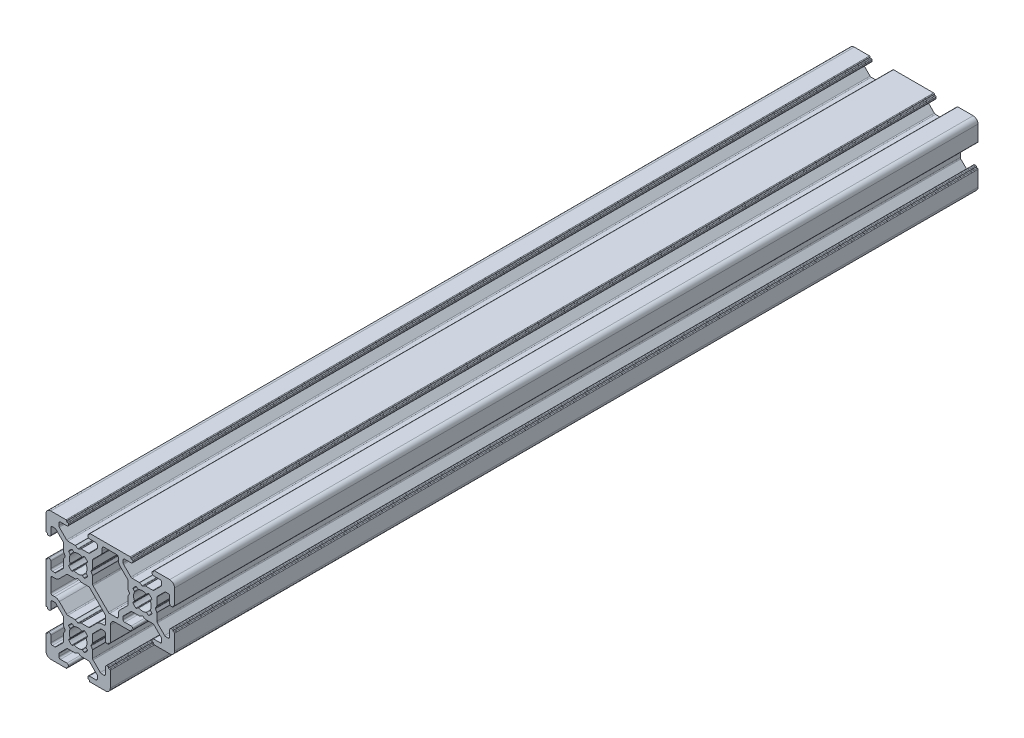
from build123d import *

# Parameters (mm, degrees)
EXTRUDE1_DEPTH = 250


with BuildPart() as part:
    # Sketch1 → Extrude1 (new body)
    with BuildSketch(Plane.XY):
        with BuildLine():
            ThreePointArc((-3.349999093, 9.500000035), (-3.491420449, 9.558578679), (-3.549999093, 9.700000035))
            Line((-3.549999093, 9.700000035), (-3.549999093, 9.8))
            ThreePointArc((-3.549999093, 9.8), (-3.608577737, 9.941421356), (-3.749999093, 10))
            Line((-3.749999093, 10), (-8.5, 10))
            ThreePointArc((-8.5, 10), (-9.560660172, 9.560660172), (-10, 8.5))
            Line((-10, 8.5), (-10, 3.74999686))
            ThreePointArc((-10, 3.74999686), (-9.941421356, 3.608575504), (-9.8, 3.54999686))
            Line((-9.8, 3.54999686), (-9.699999974, 3.54999686))
            ThreePointArc((-9.699999974, 3.54999686), (-9.558578617, 3.491418217), (-9.499999974, 3.34999686))
            Line((-9.499999974, 3.34999686), (-9.499999974, 3.2))
            ThreePointArc((-9.499999974, 3.2), (-9.44142133, 3.058578644), (-9.299999974, 3))
            Line((-9.299999974, 3), (-9.000000004, 3))
            ThreePointArc((-9.000000004, 3), (-8.646446614, 3.146446609), (-8.500000004, 3.5))
            Line((-8.500000004, 3.5), (-8.500000004, 5.499996953))
            ThreePointArc((-8.500000004, 5.499996953), (-8.353553395, 5.853550343), (-8.000000004, 5.999996953))
            Line((-8.000000004, 5.999996953), (-7.267766701, 5.999996953))
            ThreePointArc((-7.267766701, 5.999996953), (-7.076425, 5.961936725), (-6.914213334, 5.853550367))
            Line((-6.914213334, 5.853550367), (-4.646446288, 3.58578362))
            ThreePointArc((-4.646446288, 3.58578362), (-4.538059895, 3.423571938), (-4.499999655, 3.232230206))
            Line((-4.499999655, 3.232230206), (-4.499999655, 0.953586855))
            ThreePointArc((-4.499999655, 0.953586855), (-4.493184823, 0.901823054), (-4.473204745, 0.85358687))
            Line((-4.473204745, 0.85358687), (-4.038120056, 0.099997927))
            ThreePointArc((-4.038120056, 0.099997927), (-4.011325146, -2.058e-06), (-4.038120056, -0.100002042))
            Line((-4.038120056, -0.100002042), (-4.473204745, -0.853590986))
            ThreePointArc((-4.473204745, -0.853590986), (-4.493184823, -0.90182717), (-4.499999655, -0.95359097))
            Line((-4.499999655, -0.95359097), (-4.499999655, -3.232234321))
            ThreePointArc((-4.499999655, -3.232234321), (-4.538059901, -3.423576066), (-4.646446308, -3.585787755))
            Line((-4.646446308, -3.585787755), (-6.91421348, -5.853554375))
            ThreePointArc((-6.91421348, -5.853554375), (-7.076425139, -5.961940719), (-7.267766827, -6.000000942))
            Line((-7.267766827, -6.000000942), (-8.000000004, -6.000000942))
            ThreePointArc((-8.000000004, -6.000000942), (-8.353553395, -5.853554332), (-8.500000004, -5.500000942))
            Line((-8.500000004, -5.500000942), (-8.500000004, -3.5))
            ThreePointArc((-8.500000004, -3.5), (-8.646446614, -3.146446609), (-9.000000004, -3))
            Line((-9.000000004, -3), (-9.299999932, -3))
            ThreePointArc((-9.299999932, -3), (-9.441421288, -3.058578644), (-9.499999932, -3.2))
            Line((-9.499999932, -3.2), (-9.499999932, -3.350000313))
            ThreePointArc((-9.499999932, -3.350000313), (-9.558578576, -3.491421669), (-9.699999932, -3.550000313))
            Line((-9.699999932, -3.550000313), (-9.8, -3.550000313))
            ThreePointArc((-9.8, -3.550000313), (-9.941421356, -3.608578957), (-10, -3.750000313))
            Line((-10, -3.750000313), (-10, -16.250001185))
            ThreePointArc((-10, -16.250001185), (-9.941421356, -16.391422541), (-9.8, -16.450001185))
            Line((-9.8, -16.450001185), (-9.699999983, -16.450001185))
            ThreePointArc((-9.699999983, -16.450001185), (-9.558578627, -16.508579828), (-9.499999983, -16.650001185))
            Line((-9.499999983, -16.650001185), (-9.499999983, -16.8))
            ThreePointArc((-9.499999983, -16.8), (-9.44142134, -16.941421356), (-9.299999983, -17))
            Line((-9.299999983, -17), (-9.000000004, -17))
            ThreePointArc((-9.000000004, -17), (-8.646446614, -16.853553391), (-8.500000004, -16.5))
            Line((-8.500000004, -16.5), (-8.500000004, -14.500001126))
            ThreePointArc((-8.500000004, -14.500001126), (-8.353553395, -14.146447735), (-8.000000004, -14.000001126))
            Line((-8.000000004, -14.000001126), (-7.267766646, -14.000001126))
            ThreePointArc((-7.267766646, -14.000001126), (-7.07642494, -14.038061356), (-6.91421327, -14.146447721))
            Line((-6.91421327, -14.146447721), (-4.646446279, -16.414214522))
            ThreePointArc((-4.646446279, -16.414214522), (-4.538059893, -16.576426202), (-4.499999655, -16.767767927))
            Line((-4.499999655, -16.767767927), (-4.499999655, -19.046411279))
            ThreePointArc((-4.499999655, -19.046411279), (-4.493184822, -19.098175082), (-4.473204743, -19.146411267))
            Line((-4.473204743, -19.146411267), (-4.038120036, -19.9000002))
            ThreePointArc((-4.038120036, -19.9000002), (-4.011325123, -20.000000189), (-4.038120036, -20.100000178))
            Line((-4.038120036, -20.100000178), (-4.473204743, -20.853589111))
            ThreePointArc((-4.473204743, -20.853589111), (-4.493184822, -20.901825297), (-4.499999655, -20.953589099))
            Line((-4.499999655, -20.953589099), (-4.499999655, -23.232232451))
            ThreePointArc((-4.499999655, -23.232232451), (-4.53805988, -23.423574146), (-4.646446233, -23.585785809))
            Line((-4.646446233, -23.585785809), (-6.914212923, -25.853552911))
            ThreePointArc((-6.914212923, -25.853552911), (-7.076424609, -25.96193931), (-7.267766346, -25.999999552))
            Line((-7.267766346, -25.999999552), (-8.000000004, -25.999999552))
            ThreePointArc((-8.000000004, -25.999999552), (-8.353553395, -25.853552943), (-8.500000004, -25.499999552))
            Line((-8.500000004, -25.499999552), (-8.500000004, -23.5))
            ThreePointArc((-8.500000004, -23.5), (-8.646446614, -23.146446609), (-9.000000004, -23))
            Line((-9.000000004, -23), (-9.300000017, -23))
            ThreePointArc((-9.300000017, -23), (-9.441421373, -23.058578644), (-9.500000017, -23.2))
            Line((-9.500000017, -23.2), (-9.500000017, -23.349999221))
            ThreePointArc((-9.500000017, -23.349999221), (-9.55857866, -23.491420577), (-9.700000017, -23.549999221))
            Line((-9.700000017, -23.549999221), (-9.8, -23.549999221))
            ThreePointArc((-9.8, -23.549999221), (-9.941421356, -23.608577865), (-10, -23.749999221))
            Line((-10, -23.749999221), (-10, -28.5))
            ThreePointArc((-10, -28.5), (-9.560660172, -29.560660172), (-8.5, -30))
            Line((-8.5, -30), (-3.7, -30))
            ThreePointArc((-3.7, -30), (-3.558578644, -29.941421356), (-3.5, -29.8))
            Line((-3.5, -29.8), (-3.5, -29.700000035))
            ThreePointArc((-3.5, -29.700000035), (-3.441421356, -29.558578679), (-3.3, -29.500000035))
            Line((-3.3, -29.500000035), (-3.2, -29.500000035))
            ThreePointArc((-3.2, -29.500000035), (-3.058578644, -29.441421391), (-3, -29.300000035))
            Line((-3, -29.300000035), (-3, -28.999999024))
            ThreePointArc((-3, -28.999999024), (-3.146446609, -28.646445633), (-3.5, -28.499999024))
            Line((-3.5, -28.499999024), (-5.499999354, -28.499999024))
            ThreePointArc((-5.499999354, -28.499999024), (-5.853552745, -28.353552415), (-5.999999354, -27.999999024))
            Line((-5.999999354, -27.999999024), (-5.999999354, -27.267766099))
            ThreePointArc((-5.999999354, -27.267766099), (-5.961939116, -27.076424371), (-5.853552727, -26.914212691))
            Line((-5.853552727, -26.914212691), (-3.585785721, -24.646445905))
            ThreePointArc((-3.585785721, -24.646445905), (-3.423574052, -24.538059542), (-3.232232347, -24.499999313))
            Line((-3.232232347, -24.499999313), (-0.953588906, -24.499999313))
            ThreePointArc((-0.953588906, -24.499999313), (-0.9018251, -24.493184479), (-0.853588911, -24.473204396))
            Line((-0.853588911, -24.473204396), (-0.099999996, -24.038119658))
            ThreePointArc((-0.099999996, -24.038119658), (5e-09, -24.011324741), (0.100000004, -24.038119663))
            Line((0.100000004, -24.038119663), (0.853588898, -24.473204438))
            ThreePointArc((0.853588898, -24.473204438), (0.901825091, -24.493184524), (0.953588902, -24.49999936))
            Line((0.953588902, -24.49999936), (3.232232236, -24.49999936))
            ThreePointArc((3.232232236, -24.49999936), (3.423573952, -24.538059593), (3.585785626, -24.646445969))
            Line((3.585785626, -24.646445969), (5.853552522, -26.914212865))
            ThreePointArc((5.853552522, -26.914212865), (5.961938898, -27.07642454), (5.999999132, -27.267766256))
            Line((5.999999132, -27.267766256), (5.999999132, -27.999999024))
            ThreePointArc((5.999999132, -27.999999024), (5.853552522, -28.353552415), (5.499999132, -28.499999024))
            Line((5.499999132, -28.499999024), (3.5, -28.499999024))
            ThreePointArc((3.5, -28.499999024), (3.146446609, -28.646445633), (3, -28.999999024))
            Line((3, -28.999999024), (3, -29.299999459))
            ThreePointArc((3, -29.299999459), (3.058578644, -29.441420815), (3.2, -29.499999459))
            Line((3.2, -29.499999459), (3.299999981, -29.499999459))
            ThreePointArc((3.299999981, -29.499999459), (3.441421337, -29.558578103), (3.499999981, -29.699999459))
            Line((3.499999981, -29.699999459), (3.499999981, -29.8))
            ThreePointArc((3.499999981, -29.8), (3.558578624, -29.941421356), (3.699999981, -30))
            Line((3.699999981, -30), (8.5, -30))
            ThreePointArc((8.5, -30), (9.560660172, -29.560660172), (10, -28.5))
            Line((10, -28.5), (10, -23.700000019))
            ThreePointArc((10, -23.700000019), (9.941421356, -23.558578663), (9.8, -23.500000019))
            Line((9.8, -23.500000019), (9.700000017, -23.500000019))
            ThreePointArc((9.700000017, -23.500000019), (9.55857866, -23.441421376), (9.500000017, -23.300000019))
            Line((9.500000017, -23.300000019), (9.500000017, -23.2))
            ThreePointArc((9.500000017, -23.2), (9.441421373, -23.058578644), (9.300000017, -23))
            Line((9.300000017, -23), (9.000000004, -23))
            ThreePointArc((9.000000004, -23), (8.646446614, -23.146446609), (8.500000004, -23.5))
            Line((8.500000004, -23.5), (8.500000004, -25.499999272))
            ThreePointArc((8.500000004, -25.499999272), (8.353553395, -25.853552663), (8.000000004, -25.999999272))
            Line((8.000000004, -25.999999272), (7.267766483, -25.999999272))
            ThreePointArc((7.267766483, -25.999999272), (7.076424756, -25.961939034), (6.914213075, -25.853552645))
            Line((6.914213075, -25.853552645), (4.64644629, -23.585785639))
            ThreePointArc((4.64644629, -23.585785639), (4.538059927, -23.42357397), (4.499999697, -23.232232265))
            Line((4.499999697, -23.232232265), (4.499999697, -20.953588914))
            ThreePointArc((4.499999697, -20.953588914), (4.493184866, -20.901825115), (4.473204789, -20.853588932))
            Line((4.473204789, -20.853588932), (4.038120113, -20.099999981))
            ThreePointArc((4.038120113, -20.099999981), (4.011325205, -20), (4.038120113, -19.900000019))
            Line((4.038120113, -19.900000019), (4.473204789, -19.146411068))
            ThreePointArc((4.473204789, -19.146411068), (4.493184866, -19.098174885), (4.499999697, -19.046411086))
            Line((4.499999697, -19.046411086), (4.499999697, -16.767767735))
            ThreePointArc((4.499999697, -16.767767735), (4.538059931, -16.576426018), (4.646446307, -16.414214344))
            Line((4.646446307, -16.414214344), (6.914213203, -14.146447448))
            ThreePointArc((6.914213203, -14.146447448), (7.076424877, -14.038061072), (7.267766594, -14.000000839))
            Line((7.267766594, -14.000000839), (8.000000004, -14.000000839))
            ThreePointArc((8.000000004, -14.000000839), (8.353553395, -14.146447448), (8.500000004, -14.500000839))
            Line((8.500000004, -14.500000839), (8.500000004, -16.5))
            ThreePointArc((8.500000004, -16.5), (8.646446614, -16.853553391), (9.000000004, -17))
            Line((9.000000004, -17), (9.299999983, -17))
            ThreePointArc((9.299999983, -17), (9.44142134, -16.941421356), (9.499999983, -16.8))
            Line((9.499999983, -16.8), (9.499999983, -16.700000055))
            ThreePointArc((9.499999983, -16.700000055), (9.558578627, -16.558578699), (9.699999983, -16.500000055))
            Line((9.699999983, -16.500000055), (9.8, -16.500000055))
            ThreePointArc((9.8, -16.500000055), (9.941421356, -16.441421411), (10, -16.300000055))
            Line((10, -16.300000055), (10, -11.5))
            ThreePointArc((10, -11.5), (10.439339828, -10.439339828), (11.5, -10))
            Line((11.5, -10), (16.250000159, -10))
            ThreePointArc((16.250000159, -10), (16.391421515, -9.941421356), (16.450000159, -9.8))
            Line((16.450000159, -9.8), (16.450000159, -9.699999841))
            ThreePointArc((16.450000159, -9.699999841), (16.508578802, -9.558578485), (16.650000159, -9.499999841))
            Line((16.650000159, -9.499999841), (16.8, -9.499999841))
            ThreePointArc((16.8, -9.499999841), (16.941421356, -9.441421197), (17, -9.299999841))
            Line((17, -9.299999841), (17, -8.999999024))
            ThreePointArc((17, -8.999999024), (16.853553391, -8.646445633), (16.5, -8.499999024))
            Line((16.5, -8.499999024), (14.500002214, -8.499999024))
            ThreePointArc((14.500002214, -8.499999024), (14.146448895, -8.353552487), (14.000002214, -7.999999227))
            Line((14.000002214, -7.999999227), (14.000001917, -7.267767338))
            ThreePointArc((14.000001917, -7.267767338), (14.038062066, -7.076425653), (14.146448356, -6.914213977))
            Line((14.146448356, -6.914213977), (16.414214441, -4.646446269))
            ThreePointArc((16.414214441, -4.646446269), (16.576426159, -4.538059801), (16.767767958, -4.499999533))
            Line((16.767767958, -4.499999533), (19.046411123, -4.499999533))
            ThreePointArc((19.046411123, -4.499999533), (19.098174961, -4.493184691), (19.146411175, -4.473204584))
            Line((19.146411175, -4.473204584), (19.899999947, -4.038119598))
            ThreePointArc((19.899999947, -4.038119598), (20, -4.011324649), (20.100000053, -4.038119598))
            Line((20.100000053, -4.038119598), (20.853588825, -4.473204584))
            ThreePointArc((20.853588825, -4.473204584), (20.901825039, -4.493184691), (20.953588877, -4.499999533))
            Line((20.953588877, -4.499999533), (23.232232042, -4.499999533))
            ThreePointArc((23.232232042, -4.499999533), (23.423573758, -4.538059767), (23.585785433, -4.646446143))
            Line((23.585785433, -4.646446143), (25.853552329, -6.914213039))
            ThreePointArc((25.853552329, -6.914213039), (25.961938704, -7.076424713), (25.999998938, -7.26776643))
            Line((25.999998938, -7.26776643), (25.999998938, -7.999999024))
            ThreePointArc((25.999998938, -7.999999024), (25.853552329, -8.353552415), (25.499998938, -8.499999024))
            Line((25.499998938, -8.499999024), (23.5, -8.499999024))
            ThreePointArc((23.5, -8.499999024), (23.146446609, -8.646445633), (23, -8.999999024))
            Line((23, -8.999999024), (23, -9.3))
            ThreePointArc((23, -9.3), (23.058578644, -9.441421356), (23.2, -9.5))
            Line((23.2, -9.5), (23.3, -9.5))
            ThreePointArc((23.3, -9.5), (23.441421356, -9.558578644), (23.5, -9.7))
            Line((23.5, -9.7), (23.5, -9.8))
            ThreePointArc((23.5, -9.8), (23.558578644, -9.941421356), (23.7, -10))
            Line((23.7, -10), (28.5, -10))
            ThreePointArc((28.5, -10), (29.560660172, -9.560660172), (30, -8.5))
            Line((30, -8.5), (30, -3.699999946))
            ThreePointArc((30, -3.699999946), (29.941421356, -3.55857859), (29.8, -3.499999946))
            Line((29.8, -3.499999946), (29.699999932, -3.499999946))
            ThreePointArc((29.699999932, -3.499999946), (29.558578576, -3.441421303), (29.499999932, -3.299999946))
            Line((29.499999932, -3.299999946), (29.499999932, -3.2))
            ThreePointArc((29.499999932, -3.2), (29.441421288, -3.058578644), (29.299999932, -3))
            Line((29.299999932, -3), (29.000000004, -3))
            ThreePointArc((29.000000004, -3), (28.646446614, -3.146446609), (28.500000004, -3.5))
            Line((28.500000004, -3.5), (28.500000004, -5.499999276))
            ThreePointArc((28.500000004, -5.499999276), (28.353553395, -5.853552666), (28.000000004, -5.999999276))
            Line((28.000000004, -5.999999276), (27.26776694, -5.999999276))
            ThreePointArc((27.26776694, -5.999999276), (27.076425213, -5.961939037), (26.914213532, -5.853552649))
            Line((26.914213532, -5.853552649), (24.646446747, -3.585785642))
            ThreePointArc((24.646446747, -3.585785642), (24.538060384, -3.423573974), (24.500000155, -3.232232269))
            Line((24.500000155, -3.232232269), (24.500000155, -0.953588917))
            ThreePointArc((24.500000155, -0.953588917), (24.493185324, -0.901825123), (24.47320525, -0.853588943))
            Line((24.47320525, -0.853588943), (24.038120606, -0.099999974))
            ThreePointArc((24.038120606, -0.099999974), (24.011325701, 0), (24.038120606, 0.099999974))
            Line((24.038120606, 0.099999974), (24.47320525, 0.853588943))
            ThreePointArc((24.47320525, 0.853588943), (24.493185324, 0.901825123), (24.500000155, 0.953588917))
            Line((24.500000155, 0.953588917), (24.500000155, 3.232232269))
            ThreePointArc((24.500000155, 3.232232269), (24.538060388, 3.423573985), (24.646446764, 3.58578566))
            Line((24.646446764, 3.58578566), (26.91421366, 5.853552556))
            ThreePointArc((26.91421366, 5.853552556), (27.076425335, 5.961938931), (27.267767051, 5.999999165))
            Line((27.267767051, 5.999999165), (28.000000004, 5.999999165))
            ThreePointArc((28.000000004, 5.999999165), (28.353553395, 5.853552556), (28.500000004, 5.499999165))
            Line((28.500000004, 5.499999165), (28.500000004, 3.5))
            ThreePointArc((28.500000004, 3.5), (28.646446614, 3.146446609), (29.000000004, 3))
            Line((29.000000004, 3), (29.299999974, 3))
            ThreePointArc((29.299999974, 3), (29.44142133, 3.058578644), (29.499999974, 3.2))
            Line((29.499999974, 3.2), (29.499999974, 3.3))
            ThreePointArc((29.499999974, 3.3), (29.558578617, 3.441421356), (29.699999974, 3.5))
            Line((29.699999974, 3.5), (29.8, 3.5))
            ThreePointArc((29.8, 3.5), (29.941421356, 3.558578644), (30, 3.7))
            Line((30, 3.7), (30, 8.5))
            ThreePointArc((30, 8.5), (29.560660172, 9.560660172), (28.5, 10))
            Line((28.5, 10), (23.700000038, 10))
            ThreePointArc((23.700000038, 10), (23.558578681, 9.941421356), (23.500000038, 9.8))
            Line((23.500000038, 9.8), (23.500000038, 9.7))
            ThreePointArc((23.500000038, 9.7), (23.441421394, 9.558578644), (23.300000038, 9.5))
            Line((23.300000038, 9.5), (23.2, 9.5))
            ThreePointArc((23.2, 9.5), (23.058578644, 9.441421356), (23, 9.3))
            Line((23, 9.3), (23, 8.999999024))
            ThreePointArc((23, 8.999999024), (23.146446609, 8.646445633), (23.5, 8.499999024))
            Line((23.5, 8.499999024), (25.499997513, 8.499999024))
            ThreePointArc((25.499997513, 8.499999024), (25.853550903, 8.353552415), (25.999997513, 7.999999024))
            Line((25.999997513, 7.999999024), (25.999997513, 7.267767494))
            ThreePointArc((25.999997513, 7.267767494), (25.961937265, 7.076425745), (25.853550853, 6.914214053))
            Line((25.853550853, 6.914214053), (23.585783633, 4.64644748))
            ThreePointArc((23.585783633, 4.64644748), (23.423571976, 4.538061141), (23.232230293, 4.500000921))
            Line((23.232230293, 4.500000921), (20.953586941, 4.500000921))
            ThreePointArc((20.953586941, 4.500000921), (20.901823144, 4.49318609), (20.853586962, 4.473206014))
            Line((20.853586962, 4.473206014), (20.099998006, 4.038121346))
            ThreePointArc((20.099998006, 4.038121346), (19.999998026, 4.011326439), (19.899998047, 4.038121346))
            Line((19.899998047, 4.038121346), (19.146409091, 4.473206014))
            ThreePointArc((19.146409091, 4.473206014), (19.098172909, 4.49318609), (19.046409112, 4.500000921))
            Line((19.046409112, 4.500000921), (16.76776576, 4.500000921))
            ThreePointArc((16.76776576, 4.500000921), (16.576424022, 4.538061164), (16.414212336, 4.646447564))
            Line((16.414212336, 4.646447564), (14.146445653, 6.914214673))
            ThreePointArc((14.146445653, 6.914214673), (14.038059137, 7.076426583), (13.999998854, 7.267768569))
            Line((13.999998854, 7.267768569), (13.999998854, 7.999999024))
            ThreePointArc((13.999998854, 7.999999024), (14.146445464, 8.353552415), (14.499998854, 8.499999024))
            Line((14.499998854, 8.499999024), (16.5, 8.499999024))
            ThreePointArc((16.5, 8.499999024), (16.853553391, 8.646445633), (17, 8.999999024))
            Line((17, 8.999999024), (17, 9.299999841))
            ThreePointArc((17, 9.299999841), (16.941421356, 9.441421197), (16.8, 9.499999841))
            Line((16.8, 9.499999841), (16.599999385, 9.499999841))
            ThreePointArc((16.599999385, 9.499999841), (16.458578029, 9.558578485), (16.399999385, 9.699999841))
            Line((16.399999385, 9.699999841), (16.399999385, 9.799999995))
            ThreePointArc((16.399999385, 9.799999995), (16.341420743, 9.941421355), (16.199999385, 10))
            Line((16.199999385, 10), (3.700000038, 10))
            ThreePointArc((3.700000038, 10), (3.558578681, 9.941421356), (3.500000038, 9.8))
            Line((3.500000038, 9.8), (3.500000038, 9.699999459))
            ThreePointArc((3.500000038, 9.699999459), (3.441421394, 9.558578103), (3.300000038, 9.499999459))
            Line((3.300000038, 9.499999459), (3.2, 9.499999459))
            ThreePointArc((3.2, 9.499999459), (3.058578644, 9.441420815), (3, 9.299999459))
            Line((3, 9.299999459), (3, 8.999999024))
            ThreePointArc((3, 8.999999024), (3.146446609, 8.646445633), (3.5, 8.499999024))
            Line((3.5, 8.499999024), (5.499999619, 8.499999024))
            ThreePointArc((5.499999619, 8.499999024), (5.85355301, 8.353552415), (5.999999619, 7.999999024))
            Line((5.999999619, 7.999999024), (5.999999619, 7.267767494))
            ThreePointArc((5.999999619, 7.267767494), (5.961939372, 7.076425745), (5.853552959, 6.914214053))
            Line((5.853552959, 6.914214053), (3.585785739, 4.64644748))
            ThreePointArc((3.585785739, 4.64644748), (3.423574083, 4.538061141), (3.232232399, 4.500000921))
            Line((3.232232399, 4.500000921), (0.953589048, 4.500000921))
            ThreePointArc((0.953589048, 4.500000921), (0.90182525, 4.49318609), (0.853589068, 4.473206014))
            Line((0.853589068, 4.473206014), (0.100000113, 4.038121346))
            ThreePointArc((0.100000113, 4.038121346), (1.33e-07, 4.011326439), (-0.099999846, 4.038121346))
            Line((-0.099999846, 4.038121346), (-0.853588802, 4.473206014))
            ThreePointArc((-0.853588802, 4.473206014), (-0.901824984, 4.49318609), (-0.953588782, 4.500000921))
            Line((-0.953588782, 4.500000921), (-3.232232133, 4.500000921))
            ThreePointArc((-3.232232133, 4.500000921), (-3.423573871, 4.538061164), (-3.585785557, 4.646447564))
            Line((-3.585785557, 4.646447564), (-5.85355224, 6.914214673))
            ThreePointArc((-5.85355224, 6.914214673), (-5.961938591, 7.076426336), (-5.999998816, 7.267768031))
            Line((-5.999998816, 7.267768031), (-5.999998816, 7.999999024))
            ThreePointArc((-5.999998816, 7.999999024), (-5.853552207, 8.353552415), (-5.499998816, 8.499999024))
            Line((-5.499998816, 8.499999024), (-3.5, 8.499999024))
            ThreePointArc((-3.5, 8.499999024), (-3.146446609, 8.646445633), (-3, 8.999999024))
            Line((-3, 8.999999024), (-3, 9.300000035))
            ThreePointArc((-3, 9.300000035), (-3.058578644, 9.441421391), (-3.2, 9.500000035))
            Line((-3.2, 9.500000035), (-3.349999093, 9.500000035))
        make_face()
        with BuildLine():
            Line((2.891601882, 1.800596901), (2.525869345, 1.362297701))
            ThreePointArc((2.525869345, 1.362297701), (2.481166892, 1.260459554), (2.497774017, 1.150489009))
            ThreePointArc((2.497774017, 1.150489009), (2.75, 0), (2.497774017, -1.150489009))
            ThreePointArc((2.497774017, -1.150489009), (2.481166892, -1.260459554), (2.525869345, -1.362297701))
            Line((2.525869345, -1.362297701), (2.891601882, -1.800596901))
            ThreePointArc((2.891601882, -1.800596901), (2.937874062, -1.920565777), (2.90154698, -2.043910777))
            ThreePointArc((2.90154698, -2.043910777), (2.509635983, -2.509636105), (2.043910636, -2.90154708))
            ThreePointArc((2.043910636, -2.90154708), (1.920565634, -2.937874155), (1.80059676, -2.891601969))
            Line((1.80059676, -2.891601969), (1.362297578, -2.525869411))
            ThreePointArc((1.362297578, -2.525869411), (1.260459433, -2.481166953), (1.150488887, -2.497774073))
            ThreePointArc((1.150488887, -2.497774073), (0.003771764, -2.749997413), (-1.143632919, -2.50092058))
            ThreePointArc((-1.143632919, -2.50092058), (-1.253648606, -2.484615182), (-1.355363744, -2.529596824))
            Line((-1.355363744, -2.529596824), (-1.792658037, -2.896530304))
            ThreePointArc((-1.792658037, -2.896530304), (-1.91249953, -2.943131403), (-2.035943717, -2.907142811))
            ThreePointArc((-2.035943717, -2.907142811), (-2.506191529, -2.513075837), (-2.90154698, -2.043910777))
            ThreePointArc((-2.90154698, -2.043910777), (-2.937862671, -1.920291704), (-2.891249812, -1.80017615))
            Line((-2.891249812, -1.80017615), (-2.524316353, -1.362881839))
            ThreePointArc((-2.524316353, -1.362881839), (-2.480347373, -1.261339557), (-2.497095362, -1.151961263))
            ThreePointArc((-2.497095362, -1.151961263), (-2.74997358, 0.012054474), (-2.48690038, 1.173808544))
            ThreePointArc((-2.48690038, 1.173808544), (-2.481329958, 1.273149679), (-2.524316353, 1.362881839))
            Line((-2.524316353, 1.362881839), (-2.891249812, 1.80017615))
            ThreePointArc((-2.891249812, 1.80017615), (-2.937862671, 1.920291704), (-2.90154698, 2.043910777))
            ThreePointArc((-2.90154698, 2.043910777), (-2.509635983, 2.509636105), (-2.043910636, 2.90154708))
            ThreePointArc((-2.043910636, 2.90154708), (-1.920565634, 2.937874155), (-1.80059676, 2.891601969))
            Line((-1.80059676, 2.891601969), (-1.362297578, 2.525869411))
            ThreePointArc((-1.362297578, 2.525869411), (-1.260459433, 2.481166953), (-1.150488887, 2.497774073))
            ThreePointArc((-1.150488887, 2.497774073), (0, 2.75), (1.150488887, 2.497774073))
            ThreePointArc((1.150488887, 2.497774073), (1.260459433, 2.481166953), (1.362297578, 2.525869411))
            Line((1.362297578, 2.525869411), (1.80059676, 2.891601969))
            ThreePointArc((1.80059676, 2.891601969), (1.920565634, 2.937874155), (2.043910636, 2.90154708))
            ThreePointArc((2.043910636, 2.90154708), (2.509635983, 2.509636105), (2.90154698, 2.043910777))
            ThreePointArc((2.90154698, 2.043910777), (2.937874062, 1.920565777), (2.891601882, 1.800596901))
        make_face(mode=Mode.SUBTRACT)
        with BuildLine():
            Line((-1.80059676, -17.108398031), (-1.362297578, -17.474130589))
            ThreePointArc((-1.362297578, -17.474130589), (-1.260459433, -17.518833047), (-1.150488887, -17.502225927))
            ThreePointArc((-1.150488887, -17.502225927), (1.34e-07, -17.25), (1.150489131, -17.502226039))
            ThreePointArc((1.150489131, -17.502226039), (1.260459675, -17.51883317), (1.362297824, -17.474130722))
            Line((1.362297824, -17.474130722), (1.800597042, -17.108398206))
            ThreePointArc((1.800597042, -17.108398206), (1.92056592, -17.062126032), (2.043910919, -17.098453119))
            ThreePointArc((2.043910919, -17.098453119), (2.509636227, -17.49036414), (2.901547179, -17.956089505))
            ThreePointArc((2.901547179, -17.956089505), (2.937874249, -18.079434509), (2.891602057, -18.199403381))
            Line((2.891602057, -18.199403381), (2.525869478, -18.637702545))
            ThreePointArc((2.525869478, -18.637702545), (2.481167014, -18.739540688), (2.497774129, -18.849511234))
            ThreePointArc((2.497774129, -18.849511234), (2.75, -20.000000134), (2.497774017, -21.150489009))
            ThreePointArc((2.497774017, -21.150489009), (2.481166892, -21.260459554), (2.525869345, -21.362297701))
            Line((2.525869345, -21.362297701), (2.891601882, -21.800596901))
            ThreePointArc((2.891601882, -21.800596901), (2.937874062, -21.920565777), (2.90154698, -22.043910777))
            ThreePointArc((2.90154698, -22.043910777), (2.509635983, -22.509636105), (2.043910636, -22.90154708))
            ThreePointArc((2.043910636, -22.90154708), (1.920565634, -22.937874155), (1.80059676, -22.891601969))
            Line((1.80059676, -22.891601969), (1.362297578, -22.525869411))
            ThreePointArc((1.362297578, -22.525869411), (1.260459433, -22.481166953), (1.150488887, -22.497774073))
            ThreePointArc((1.150488887, -22.497774073), (-1.34e-07, -22.75), (-1.150489131, -22.497773961))
            ThreePointArc((-1.150489131, -22.497773961), (-1.260459675, -22.48116683), (-1.362297824, -22.525869278))
            Line((-1.362297824, -22.525869278), (-1.800597042, -22.891601794))
            ThreePointArc((-1.800597042, -22.891601794), (-1.92056592, -22.937873968), (-2.043910919, -22.901546881))
            ThreePointArc((-2.043910919, -22.901546881), (-2.509636227, -22.50963586), (-2.901547179, -22.043910495))
            ThreePointArc((-2.901547179, -22.043910495), (-2.937874249, -21.920565491), (-2.891602057, -21.800596619))
            Line((-2.891602057, -21.800596619), (-2.525869478, -21.362297455))
            ThreePointArc((-2.525869478, -21.362297455), (-2.481167014, -21.260459312), (-2.497774129, -21.150488766))
            ThreePointArc((-2.497774129, -21.150488766), (-2.75, -19.999999866), (-2.497774017, -18.849510991))
            ThreePointArc((-2.497774017, -18.849510991), (-2.481166892, -18.739540446), (-2.525869345, -18.637702299))
            Line((-2.525869345, -18.637702299), (-2.891601882, -18.199403099))
            ThreePointArc((-2.891601882, -18.199403099), (-2.937874062, -18.079434223), (-2.90154698, -17.956089223))
            ThreePointArc((-2.90154698, -17.956089223), (-2.509635983, -17.490363895), (-2.043910636, -17.09845292))
            ThreePointArc((-2.043910636, -17.09845292), (-1.920565634, -17.062125845), (-1.80059676, -17.108398031))
        make_face(mode=Mode.SUBTRACT)
        with BuildLine():
            ThreePointArc((-3.585784816, -4.646446143), (-3.423573142, -4.538059767), (-3.232231426, -4.499999533))
            Line((-3.232231426, -4.499999533), (-0.953588261, -4.499999533))
            ThreePointArc((-0.953588261, -4.499999533), (-0.901824463, -4.493184702), (-0.853588281, -4.473204626))
            Line((-0.853588281, -4.473204626), (-0.099999326, -4.038119959))
            ThreePointArc((-0.099999326, -4.038119959), (6.54e-07, -4.011325051), (0.100000633, -4.038119959))
            Line((0.100000633, -4.038119959), (0.853589589, -4.473204626))
            ThreePointArc((0.853589589, -4.473204626), (0.901825771, -4.493184702), (0.953589569, -4.499999533))
            Line((0.953589569, -4.499999533), (3.232232733, -4.499999533))
            ThreePointArc((3.232232733, -4.499999533), (3.423574417, -4.538059754), (3.585786074, -4.646446092))
            Line((3.585786074, -4.646446092), (8.353553344, -9.414212002))
            ThreePointArc((8.353553344, -9.414212002), (8.461939757, -9.576423694), (8.500000004, -9.767765443))
            Line((8.500000004, -9.767765443), (8.500000004, -12.000000777))
            ThreePointArc((8.500000004, -12.000000777), (8.353553395, -12.353554167), (8.000000004, -12.500000777))
            Line((8.000000004, -12.500000777), (7.267766594, -12.500000777))
            ThreePointArc((7.267766594, -12.500000777), (6.502399725, -12.652241708), (5.853553018, -13.085787202))
            Line((5.853553018, -13.085787202), (3.585784564, -15.353555557))
            ThreePointArc((3.585784564, -15.353555557), (3.423572875, -15.461941934), (3.232231145, -15.500002159))
            Line((3.232231145, -15.500002159), (0.953590664, -15.500001993))
            ThreePointArc((0.953590664, -15.500001993), (0.901826855, -15.506816824), (0.853590662, -15.526796904))
            Line((0.853590662, -15.526796904), (0.100001726, -15.961881606))
            ThreePointArc((0.100001726, -15.961881606), (1.724e-06, -15.988676518), (-0.099998274, -15.961881592))
            Line((-0.099998274, -15.961881592), (-0.853587146, -15.52679678))
            ThreePointArc((-0.853587146, -15.52679678), (-0.90182338, -15.50681668), (-0.953587236, -15.500001853))
            Line((-0.953587236, -15.500001853), (-3.232231076, -15.500002731))
            ThreePointArc((-3.232231076, -15.500002731), (-3.423572907, -15.461942529), (-3.585784677, -15.353556104))
            Line((-3.585784677, -15.353556104), (-5.853552971, -13.085787589))
            ThreePointArc((-5.853552971, -13.085787589), (-6.502399713, -12.652242022), (-7.267766646, -12.500001064))
            Line((-7.267766646, -12.500001064), (-8.000000004, -12.500001064))
            ThreePointArc((-8.000000004, -12.500001064), (-8.353553395, -12.353554455), (-8.500000004, -12.000001064))
            Line((-8.500000004, -12.000001064), (-8.500000004, -8.000001004))
            ThreePointArc((-8.500000004, -8.000001004), (-8.353553395, -7.646447613), (-8.000000003, -7.500001004))
            Line((-8.000000003, -7.500001004), (-7.267766827, -7.500001004))
            ThreePointArc((-7.267766827, -7.500001004), (-6.502399939, -7.347760064), (-5.853553221, -6.914214548))
            Line((-5.853553221, -6.914214548), (-3.585784816, -4.646446143))
        make_face(mode=Mode.SUBTRACT)
        with BuildLine():
            ThreePointArc((17.09845302, 2.043910777), (17.490364017, 2.509636105), (17.956089364, 2.90154708))
            ThreePointArc((17.956089364, 2.90154708), (18.07970844, 2.937862765), (18.199823991, 2.8912499))
            Line((18.199823991, 2.8912499), (18.642781084, 2.531172837))
            ThreePointArc((18.642781084, 2.531172837), (18.745145787, 2.484782204), (18.856367081, 2.50092058))
            ThreePointArc((18.856367081, 2.50092058), (20, 2.75), (21.143632919, 2.50092058))
            ThreePointArc((21.143632919, 2.50092058), (21.253648606, 2.484615182), (21.355363744, 2.529596824))
            Line((21.355363744, 2.529596824), (21.798320837, 2.889673887))
            ThreePointArc((21.798320837, 2.889673887), (21.919075686, 2.93780769), (22.043910636, 2.90154708))
            ThreePointArc((22.043910636, 2.90154708), (22.509635983, 2.509636105), (22.90154698, 2.043910777))
            ThreePointArc((22.90154698, 2.043910777), (22.937807597, 1.919075829), (22.8896738, 1.798320977))
            Line((22.8896738, 1.798320977), (22.529596758, 1.355363867))
            ThreePointArc((22.529596758, 1.355363867), (22.484615121, 1.253648727), (22.500920524, 1.143633041))
            ThreePointArc((22.500920524, 1.143633041), (22.75, 0), (22.500920524, -1.143633041))
            ThreePointArc((22.500920524, -1.143633041), (22.484615121, -1.253648727), (22.529596758, -1.355363867))
            Line((22.529596758, -1.355363867), (22.8896738, -1.798320977))
            ThreePointArc((22.8896738, -1.798320977), (22.937807597, -1.919075829), (22.90154698, -2.043910777))
            ThreePointArc((22.90154698, -2.043910777), (22.509635983, -2.509636105), (22.043910636, -2.90154708))
            ThreePointArc((22.043910636, -2.90154708), (21.919075686, -2.93780769), (21.798320837, -2.889673887))
            Line((21.798320837, -2.889673887), (21.355363744, -2.529596824))
            ThreePointArc((21.355363744, -2.529596824), (21.253648606, -2.484615182), (21.143632919, -2.50092058))
            ThreePointArc((21.143632919, -2.50092058), (20, -2.75), (18.856367081, -2.50092058))
            ThreePointArc((18.856367081, -2.50092058), (18.745145787, -2.484782204), (18.642781084, -2.531172837))
            Line((18.642781084, -2.531172837), (18.199823991, -2.8912499))
            ThreePointArc((18.199823991, -2.8912499), (18.07970844, -2.937862765), (17.956089364, -2.90154708))
            ThreePointArc((17.956089364, -2.90154708), (17.490364017, -2.509636105), (17.09845302, -2.043910777))
            ThreePointArc((17.09845302, -2.043910777), (17.062137329, -1.920291704), (17.108750188, -1.80017615))
            Line((17.108750188, -1.80017615), (17.468827229, -1.35721904))
            ThreePointArc((17.468827229, -1.35721904), (17.515217857, -1.254854334), (17.499079476, -1.143633041))
            ThreePointArc((17.499079476, -1.143633041), (17.25, 0), (17.499079476, 1.143633041))
            ThreePointArc((17.499079476, 1.143633041), (17.515217857, 1.254854334), (17.468827229, 1.35721904))
            Line((17.468827229, 1.35721904), (17.108750188, 1.80017615))
            ThreePointArc((17.108750188, 1.80017615), (17.062137329, 1.920291704), (17.09845302, 2.043910777))
        make_face(mode=Mode.SUBTRACT)
        with BuildLine():
            Line((4.499999697, 0.953588556), (4.499999697, 3.232231908))
            ThreePointArc((4.499999697, 3.232231908), (4.538059896, 3.423573539), (4.646446177, 3.585785168))
            Line((4.646446177, 3.585785168), (6.914213746, 5.853554409))
            ThreePointArc((6.914213746, 5.853554409), (7.347758882, 6.502400946), (7.499999681, 7.267767494))
            Line((7.499999681, 7.267767494), (7.499999681, 7.999999024))
            ThreePointArc((7.499999681, 7.999999024), (7.646446291, 8.353552415), (7.999999681, 8.499999024))
            Line((7.999999681, 8.499999024), (11.999999553, 8.499999024))
            ThreePointArc((11.999999553, 8.499999024), (12.353552944, 8.353552415), (12.499999553, 7.999999024))
            Line((12.499999553, 7.999999024), (12.499999553, 7.267768569))
            ThreePointArc((12.499999553, 7.267768569), (12.652240448, 6.502401788), (13.085785843, 5.853555128))
            Line((13.085785843, 5.853555128), (15.353553983, 3.585786458))
            ThreePointArc((15.353553983, 3.585786458), (15.461940328, 3.423574797), (15.500000551, 3.232233108))
            Line((15.500000551, 3.232233108), (15.500000551, 0.953589757))
            ThreePointArc((15.500000551, 0.953589757), (15.506815385, 0.901825951), (15.526795467, 0.853589762))
            Line((15.526795467, 0.853589762), (15.961880202, 0.100000845))
            ThreePointArc((15.961880202, 0.100000845), (15.988675118, 8.5e-07), (15.961880202, -0.099999145))
            Line((15.961880202, -0.099999145), (15.526795467, -0.853588062))
            ThreePointArc((15.526795467, -0.853588062), (15.506815385, -0.901824251), (15.500000551, -0.953588057))
            Line((15.500000551, -0.953588057), (15.500000551, -3.232231408))
            ThreePointArc((15.500000551, -3.232231408), (15.461940379, -3.423572974), (15.353554171, -3.585784569))
            Line((15.353554171, -3.585784569), (13.085787241, -5.853554449))
            ThreePointArc((13.085787241, -5.853554449), (12.652242241, -6.502401223), (12.500001705, -7.267767948))
            Line((12.500001705, -7.267767948), (12.500002003, -7.999998821))
            ThreePointArc((12.500002003, -7.999998821), (12.353555465, -8.353552343), (12.000002003, -8.499999024))
            Line((12.000002003, -8.499999024), (9.767766469, -8.499999024))
            ThreePointArc((9.767766469, -8.499999024), (9.576424761, -8.461938794), (9.414213091, -8.353552428))
            Line((9.414213091, -8.353552428), (4.64644632, -3.585786019))
            ThreePointArc((4.64644632, -3.585786019), (4.538059935, -3.42357434), (4.499999697, -3.232232615))
            Line((4.499999697, -3.232232615), (4.499999697, -0.953589263))
            ThreePointArc((4.499999697, -0.953589263), (4.493184864, -0.90182546), (4.473204784, -0.853589274))
            Line((4.473204784, -0.853589274), (4.038120075, -0.100000343))
            ThreePointArc((4.038120075, -0.100000343), (4.011325162, -3.53e-07), (4.038120075, 0.099999636))
            Line((4.038120075, 0.099999636), (4.473204784, 0.853588567))
            ThreePointArc((4.473204784, 0.853588567), (4.493184864, 0.901824753), (4.499999697, 0.953588556))
        make_face(mode=Mode.SUBTRACT)
    extrude(amount=EXTRUDE1_DEPTH)


solid = part.part
